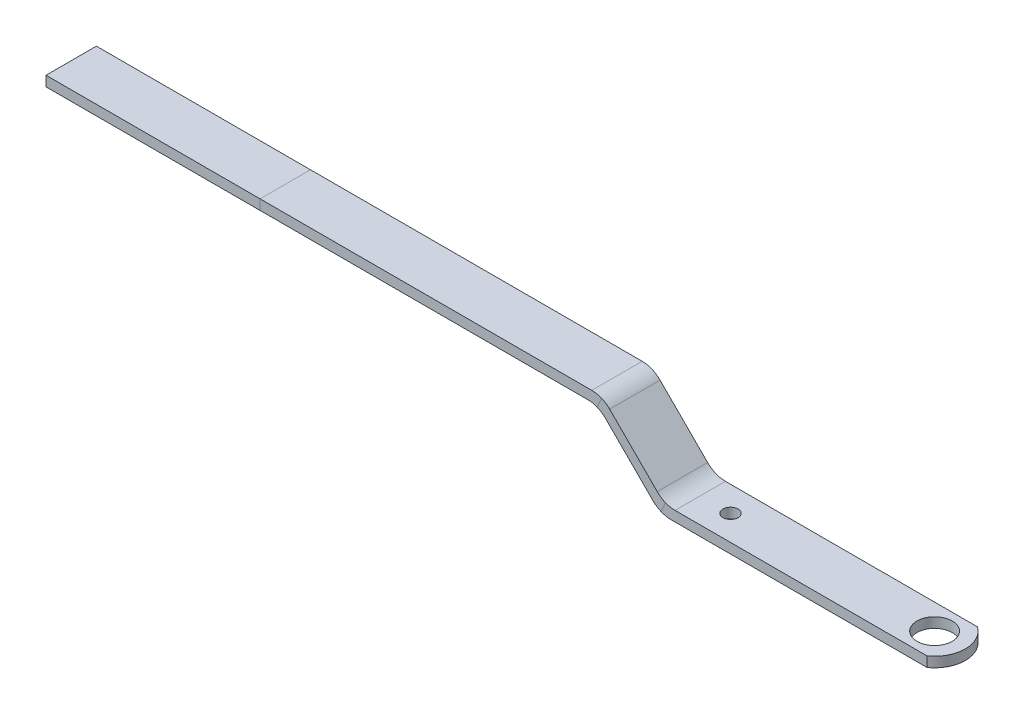
from build123d import *

# Parameters (mm, degrees)
SKETCH3_W           = 20
SKETCH3_H           = 4
FILLET1_R           = 10
BOSS_EXTRUDE1_DEPTH = 4
SKETCH4_4_R         = 7
SKETCH4_4_R_2       = 3
CUT_EXTRUDE6_DEPTH  = 4
SKETCH5_R           = 4
BOSS_EXTRUDE2_DEPTH = 2
FILLET4_R           = 2


with BuildPart() as part:
    # Sweep1: sweep along a path in Sketch2
    with BuildLine(Plane.XY) as sweep1_path:
        Line((105, 0), (0, 0))
        Line((0, 0), (-24.748737342, 24.748737342))
        Line((-24.748737342, 24.748737342), (-159.748737342, 24.748737342))
        Line((-159.748737342, 24.748737342), (-244.748737342, 24.748737342))
    # Sketch3 → Sweep1 (sweep)
    with BuildSketch(Plane(origin=(105, 0, 0), x_dir=(0, 0, -1), z_dir=(1, 0, 0))):
        Rectangle(SKETCH3_W, SKETCH3_H)
    sweep(path=sweep1_path.line, transition=Transition.RIGHT)

    # Fillet1
    fillet1_edges = [part.edges().sort_by_distance(p)[0] for p in [
        (-0.828427125, -2, 0),
        (0.828427125, 2, 0),
        (-23.920310217, 26.748737342, 0),
        (-25.577164466, 22.748737342, 0),
    ]]
    fillet(fillet1_edges, radius=FILLET1_R)

    # Sketch4 → Boss-Extrude1 (add)
    with BuildSketch(Plane(origin=(0, 2, 0), x_dir=(1, 0, 0), z_dir=(0, 1, 0))):
        with BuildLine():
            ThreePointArc((105, -10), (110.206555616, 0), (105, 10))
            Line((105, 10), (105, 0))
            Line((105, 0), (105, -10))
        make_face()
    extrude(amount=-BOSS_EXTRUDE1_DEPTH)

    # Sketch4<4> → Cut-Extrude6 (cut)
    with BuildSketch(Plane(origin=(0, 2, 0), x_dir=(1, 0, 0), z_dir=(0, 1, 0))):
        with Locations(Location((98, 0, 0), (0, 0, 270))):
            Circle(SKETCH4_4_R)
        with Locations(Location((17, 0, 0), (0, 0, 270))):
            Circle(SKETCH4_4_R_2)
    extrude(amount=-CUT_EXTRUDE6_DEPTH, mode=Mode.SUBTRACT)

    # Sketch5 → Boss-Extrude2 (add)
    with BuildSketch(Plane.XZ.offset(-22.748737342)):
        with Locations(Location((-175.748737342, 0, 0), (0, 0, 180))):
            Circle(SKETCH5_R)
    extrude(amount=BOSS_EXTRUDE2_DEPTH)

    # Fillet4
    fillet4_edges = [part.edges().sort_by_distance(p)[0] for p in [
        (-171.748737342, 20.748737342, 0),
    ]]
    fillet(fillet4_edges, radius=FILLET4_R - 0.0001)  # a hair under: the kernel refuses the full size


solid = part.part
